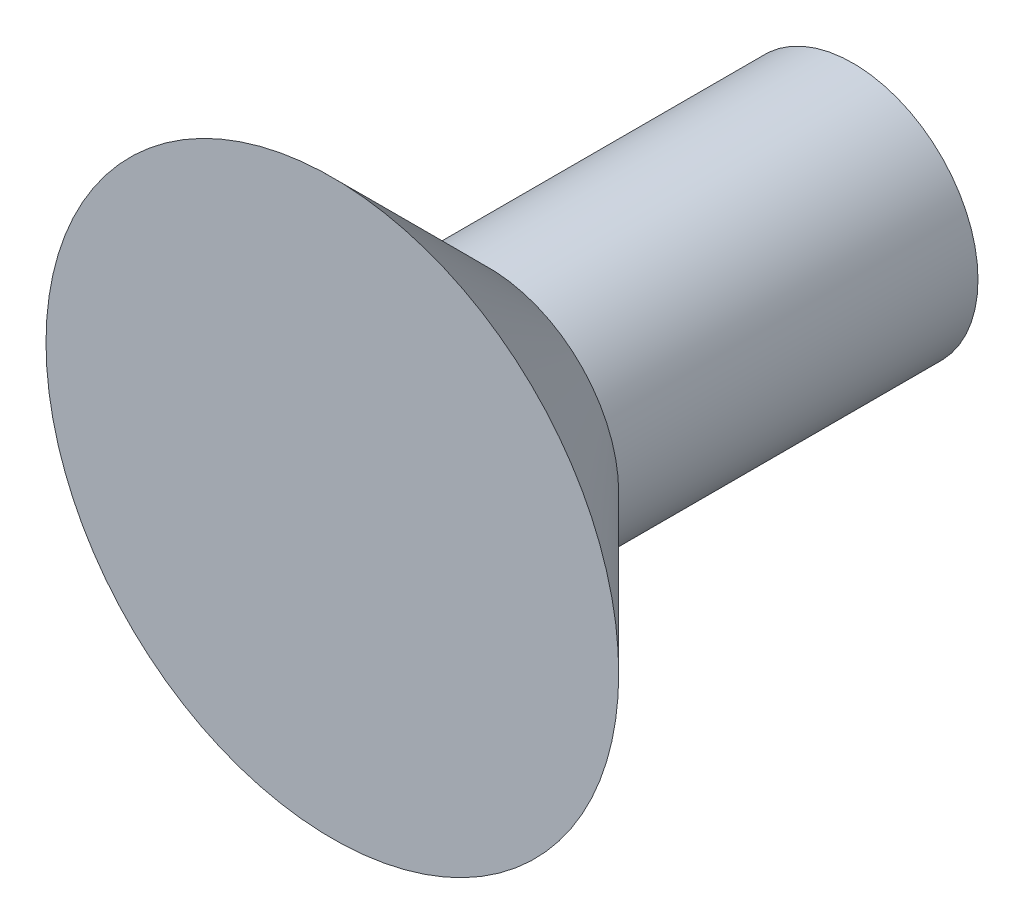
from build123d import *

# Parameters (mm, degrees)
IZIM1_R                     = 2.4
Y_KSEKLIK_EKSTR_ZYON1_DEPTH = 7
IZIM2_R                     = 2.5
Y_KSEKLIK_EKSTR_ZYON2_DEPTH = 3
Y_KSEKLIK_EKSTR_ZYON2_DRAFT = -45


with BuildPart() as part:
    # Çizim1 → Yükseklik-Ekstrüzyon1 (new body)
    with BuildSketch(Plane.XY):
        Circle(IZIM1_R)
    extrude(amount=Y_KSEKLIK_EKSTR_ZYON1_DEPTH)


with BuildPart() as y_kseklik_ekstr_zyon2_tool:
    # Çizim2 → Yükseklik-Ekstrüzyon2 (with draft: the straight prism first)
    with BuildSketch(Plane.XY.offset(7)):
        Circle(IZIM2_R)
    extrude(amount=Y_KSEKLIK_EKSTR_ZYON2_DEPTH)
    # Yükseklik-Ekstrüzyon2: the draft: its side faces are tilted about the plane it starts from
    y_kseklik_ekstr_zyon2_sides = [y_kseklik_ekstr_zyon2_tool.faces().sort_by_distance(p)[0] for p in [
        (-2.5, 0, 8.5),
    ]]
    draft(y_kseklik_ekstr_zyon2_sides, Plane.XY.offset(7), Y_KSEKLIK_EKSTR_ZYON2_DRAFT)


with BuildPart() as part_1:
    add(part.part)

    # Yükseklik-Ekstrüzyon2: add y_kseklik_ekstr_zyon2_tool
    add(y_kseklik_ekstr_zyon2_tool.part)


solid = part_1.part
